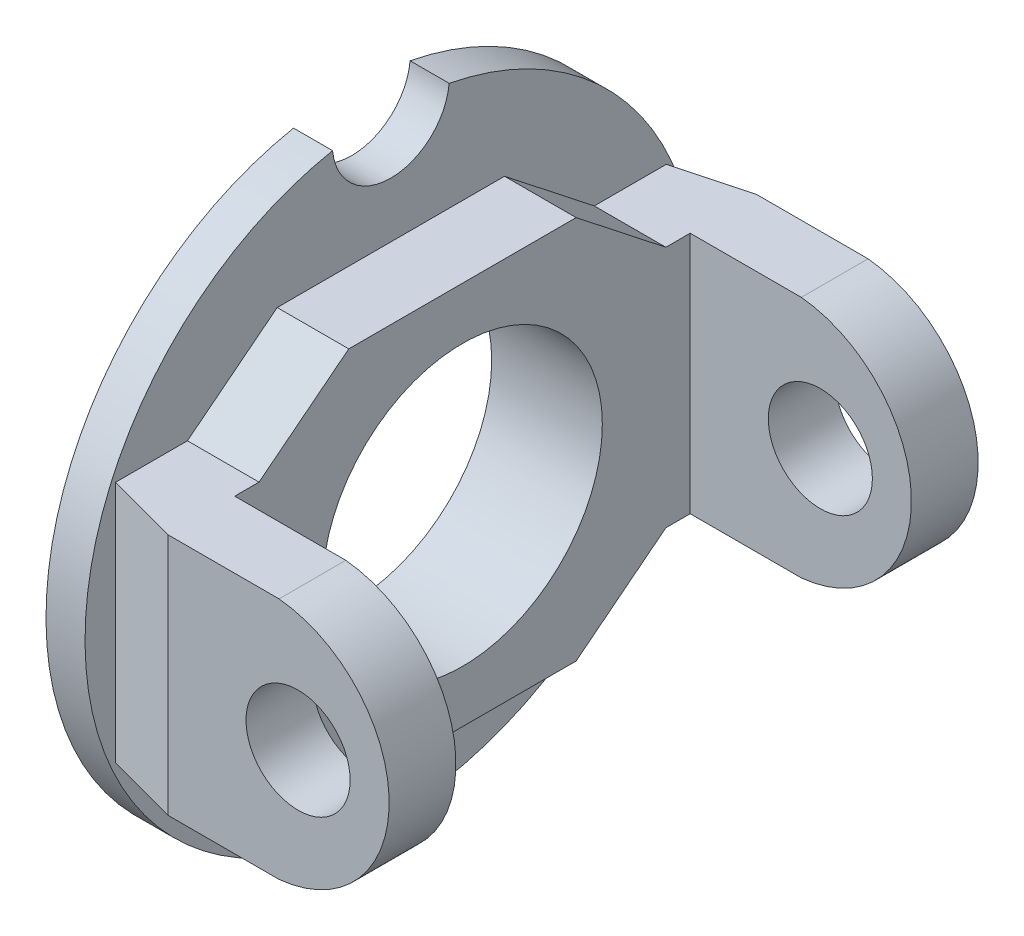
from build123d import *

# Parameters (mm, degrees)
SKETCH1_R           = 10.75
BOSS_EXTRUDE1_DEPTH = 3
SKETCH2_R           = 10.75
BOSS_EXTRUDE2_DEPTH = 5.5
DRAFT1_START        = -9.335
DRAFT1_DEPTH        = 18.67
SKETCH3_W           = 5.13
SKETCH3_H           = 18.67
BOSS_EXTRUDE3_DEPTH = 17
CUT_EXTRUDE1_REACH  = 59.71
CUT_EXTRUDE2_REACH  = 59.71
SKETCH5_R           = 4


# Read off the part's stored shape, not the designer's step: Draft1
with BuildPart() as part:
    # Sketch1 → Boss-Extrude1 (new body)
    with BuildSketch(Plane(origin=(0, 0, 0), x_dir=(0, 0, -1), z_dir=(1, 0, 0))):
        with BuildLine():
            ThreePointArc((-4.479326664, 23.069148936), (0, -23.5), (4.479326664, 23.069148936))
            ThreePointArc((4.479326664, 23.069148936), (0, 19), (-4.479326664, 23.069148936))
        make_face()
        Circle(SKETCH1_R, mode=Mode.SUBTRACT)
    extrude(amount=BOSS_EXTRUDE1_DEPTH)

    # Sketch2 → Boss-Extrude2 (add)
    # profile 1 of 7: a face of its own
    with BuildSketch(Plane(origin=(3, 0, 0), x_dir=(0, 0, -1), z_dir=(1, 0, 0))):
        with BuildLine():
            ThreePointArc((-22.63, 6.33506906), (-22.149027068, 7.853063093), (-21.566357481, 9.335))
            Line((-21.566357481, 9.335), (-22.63, 9.335))
            Line((-22.63, 9.335), (-22.63, 6.33506906))
        make_face()
    # profile 2 of 7: a face of its own
    with BuildSketch(Plane(origin=(3, 0, 0), x_dir=(0, 0, -1), z_dir=(1, 0, 0))):
        with BuildLine():
            Line((-15.63, -9.335), (-15.63, 9.335))
            Line((-15.63, 9.335), (-21.566357481, 9.335))
            ThreePointArc((-21.566357481, 9.335), (-22.149027068, 7.853063093), (-22.63, 6.33506906))
            Line((-22.63, 6.33506906), (-22.63, -6.33506906))
            ThreePointArc((-22.63, -6.33506906), (-22.149027068, -7.853063093), (-21.566357481, -9.335))
            Line((-21.566357481, -9.335), (-15.63, -9.335))
        make_face()
    # profile 3 of 7: a face of its own
    with BuildSketch(Plane(origin=(3, 0, 0), x_dir=(0, 0, -1), z_dir=(1, 0, 0))):
        with BuildLine():
            Line((-22.63, -9.335), (-21.566357481, -9.335))
            ThreePointArc((-21.566357481, -9.335), (-22.149027068, -7.853063093), (-22.63, -6.33506906))
            Line((-22.63, -6.33506906), (-22.63, -9.335))
        make_face()
    # profile 4 of 7: a face of its own
    with BuildSketch(Plane(origin=(3, 0, 0), x_dir=(0, 0, -1), z_dir=(1, 0, 0))):
        Polygon((-8.735, -14.754582548), (8.735, -14.754582548), (15.63, -9.335), (15.63, 9.335), (8.735, 14.754582548), (-8.735, 14.754582548), (-15.63, 9.335), (-15.63, -9.335), align=None)
        Circle(SKETCH2_R, mode=Mode.SUBTRACT)
    # profile 5 of 7: a face of its own
    with BuildSketch(Plane(origin=(3, 0, 0), x_dir=(0, 0, -1), z_dir=(1, 0, 0))):
        with BuildLine():
            Line((21.566357481, 9.335), (15.63, 9.335))
            Line((15.63, 9.335), (15.63, -9.335))
            Line((15.63, -9.335), (21.566357481, -9.335))
            ThreePointArc((21.566357481, -9.335), (22.149027068, -7.853063093), (22.63, -6.33506906))
            Line((22.63, -6.33506906), (22.63, 6.33506906))
            ThreePointArc((22.63, 6.33506906), (22.149027068, 7.853063093), (21.566357481, 9.335))
        make_face()
    # profile 6 of 7: a face of its own
    with BuildSketch(Plane(origin=(3, 0, 0), x_dir=(0, 0, -1), z_dir=(1, 0, 0))):
        with BuildLine():
            ThreePointArc((22.63, -6.33506906), (22.149027068, -7.853063093), (21.566357481, -9.335))
            Line((21.566357481, -9.335), (22.63, -9.335))
            Line((22.63, -9.335), (22.63, -6.33506906))
        make_face()
    # profile 7 of 7: a face of its own
    with BuildSketch(Plane(origin=(3, 0, 0), x_dir=(0, 0, -1), z_dir=(1, 0, 0))):
        with BuildLine():
            Line((22.63, 9.335), (21.566357481, 9.335))
            ThreePointArc((21.566357481, 9.335), (22.149027068, 7.853063093), (22.63, 6.33506906))
            Line((22.63, 6.33506906), (22.63, 9.335))
        make_face()
    extrude(amount=BOSS_EXTRUDE2_DEPTH)

    # Draft1 outline → Draft1 (cut)
    with BuildSketch(Plane(origin=(0, 0, 0), x_dir=(1, 0, 0), z_dir=(0, 1, 0)).offset(DRAFT1_START)):
        Polygon((3, 22.63), (3, 21.156279442), (8.5, 22.63), align=None)
        Polygon((3, -21.156279442), (3, -22.63), (8.5, -22.63), align=None)
    extrude(amount=DRAFT1_DEPTH, mode=Mode.SUBTRACT)

    # Sketch3 → Boss-Extrude3 (add)
    with BuildSketch(Plane(origin=(8.5, 0, 0), x_dir=(0, 0, -1), z_dir=(1, 0, 0))):
        with Locations((-20.065, 0)):
            Rectangle(SKETCH3_W, SKETCH3_H)
        with Locations((20.065, 0)):
            Rectangle(SKETCH3_W, SKETCH3_H)
    extrude(amount=BOSS_EXTRUDE3_DEPTH)

    # Cut-Extrude1: up to this face of the body (flat: up to its plane)
    cut_extrude1_end = Plane(part.part.faces().sort_by_distance((17, 0, -22.63))[0])
    # Sketch4 → Cut-Extrude1 (cut, up to the picked face)
    with BuildSketch(Plane.XY.offset(22.63), mode=Mode.PRIVATE) as cut_extrude1_sk1:
        with BuildLine():
            Line((17.037700932, 12.875), (29.477700932, 12.875))
            Line((29.477700932, 12.875), (29.477700932, -13.095))
            Line((29.477700932, -13.095), (17.037700932, -13.095))
            Line((17.037700932, -13.095), (17.037700932, -9.335))
            ThreePointArc((17.037700932, -9.335), (25.5, 0), (17.037700932, 9.335))
            Line((17.037700932, 9.335), (17.037700932, 12.875))
        make_face()
    cut_extrude1_tool1 = split(extrude(cut_extrude1_sk1.sketch, amount=-CUT_EXTRUDE1_REACH, mode=Mode.PRIVATE), bisect_by=cut_extrude1_end, keep=Keep.BOTH, mode=Mode.PRIVATE)
    add(cut_extrude1_tool1.solids().sort_by(Axis((17.325658, 11.105, 22.63), (0, 0, -1)))[0], mode=Mode.SUBTRACT)

    # Cut-Extrude2: up to this face of the body (flat: up to its plane)
    cut_extrude2_end = Plane(part.part.faces().sort_by_distance((16.149048437, 0, -22.63))[0])
    # Sketch5 → Cut-Extrude2 (cut, up to the picked face)
    with BuildSketch(Plane.XY.offset(22.63), mode=Mode.PRIVATE) as cut_extrude2_sk1:
        with Locations((18.5, 0)):
            Circle(SKETCH5_R)
    cut_extrude2_tool1 = split(extrude(cut_extrude2_sk1.sketch, amount=-CUT_EXTRUDE2_REACH, mode=Mode.PRIVATE), bisect_by=cut_extrude2_end, keep=Keep.BOTH, mode=Mode.PRIVATE)
    add(cut_extrude2_tool1.solids().sort_by(Axis((18.5, 0, 22.63), (0, 0, -1)))[0], mode=Mode.SUBTRACT)


solid = part.part
